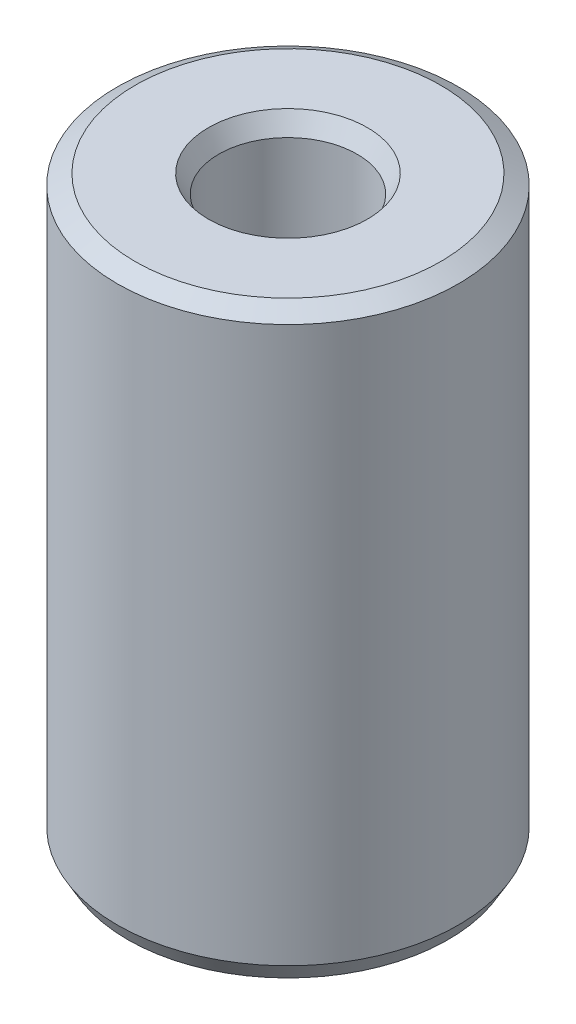
from build123d import *
from OCP.BRepFilletAPI import BRepFilletAPI_MakeChamfer

# Parameters (mm, degrees)
SKETCH1_R           = 27.5
BOSS_EXTRUDE1_DEPTH = 94.040246843
SKETCH2_R           = 11.145180351
CUT_EXTRUDE1_DEPTH  = 102.764768099
CHAMFER1_SIZE       = 1.660794774
CHAMFER1_SIZE2      = 2.87658093


with BuildPart() as part:
    # Sketch1 → Boss-Extrude1 (new body)
    with BuildSketch(Plane(origin=(0, 0, 0), x_dir=(1, 0, 0), z_dir=(0, 1, 0))):
        Circle(SKETCH1_R)
    extrude(amount=BOSS_EXTRUDE1_DEPTH)

    # Sketch2 → Cut-Extrude1 (cut, through all)
    with BuildSketch(Plane(origin=(0, 0, 0), x_dir=(1, 0, 0), z_dir=(0, 1, 0))):
        Circle(SKETCH2_R)
    extrude(amount=CUT_EXTRUDE1_DEPTH, mode=Mode.SUBTRACT)

    # Chamfer1: one chamfer whose edges measure the first distance from different faces: ONE call of the kernel's chamfer builder (chamfer() names one face for all edges)
    chamfer1_edges_1 = [part.edges().sort_by_distance(p)[0] for p in [
        (-11.145180351, 94.040246843, 0),
    ]]
    chamfer1_side_1 = [part.faces().sort_by_distance(p)[0] for p in [
        (-26.722182541, 94.040246843, 0),
    ]]
    chamfer1_edges_2 = [part.edges().sort_by_distance(p)[0] for p in [
        (-11.145180351, 0, 0),
    ]]
    chamfer1_side_2 = [part.faces().sort_by_distance(p)[0] for p in [
        (-11.145180351, 47.020123422, 0),
    ]]
    chamfer1_edges_3 = [part.edges().sort_by_distance(p)[0] for p in [
        (-27.5, 0, 0),
    ]]
    chamfer1_side_3 = [part.faces().sort_by_distance(p)[0] for p in [
        (-26.722182541, 0, 0),
    ]]
    chamfer1_edges_4 = [part.edges().sort_by_distance(p)[0] for p in [
        (-27.5, 94.040246843, 0),
    ]]
    chamfer1_side_4 = [part.faces().sort_by_distance(p)[0] for p in [
        (-27.5, 47.020123422, 0),
    ]]
    chamfer1 = BRepFilletAPI_MakeChamfer(part.part.solid().wrapped)
    for e in chamfer1_edges_1:
        chamfer1.Add(CHAMFER1_SIZE, CHAMFER1_SIZE2, e.wrapped, chamfer1_side_1[0].wrapped)  # the first distance lies on this face
    for e in chamfer1_edges_2:
        chamfer1.Add(CHAMFER1_SIZE, CHAMFER1_SIZE2, e.wrapped, chamfer1_side_2[0].wrapped)  # the first distance lies on this face
    for e in chamfer1_edges_3:
        chamfer1.Add(CHAMFER1_SIZE, CHAMFER1_SIZE2, e.wrapped, chamfer1_side_3[0].wrapped)  # the first distance lies on this face
    for e in chamfer1_edges_4:
        chamfer1.Add(CHAMFER1_SIZE, CHAMFER1_SIZE2, e.wrapped, chamfer1_side_4[0].wrapped)  # the first distance lies on this face
    add(Compound.cast(chamfer1.Shape()), mode=Mode.REPLACE)


solid = part.part
